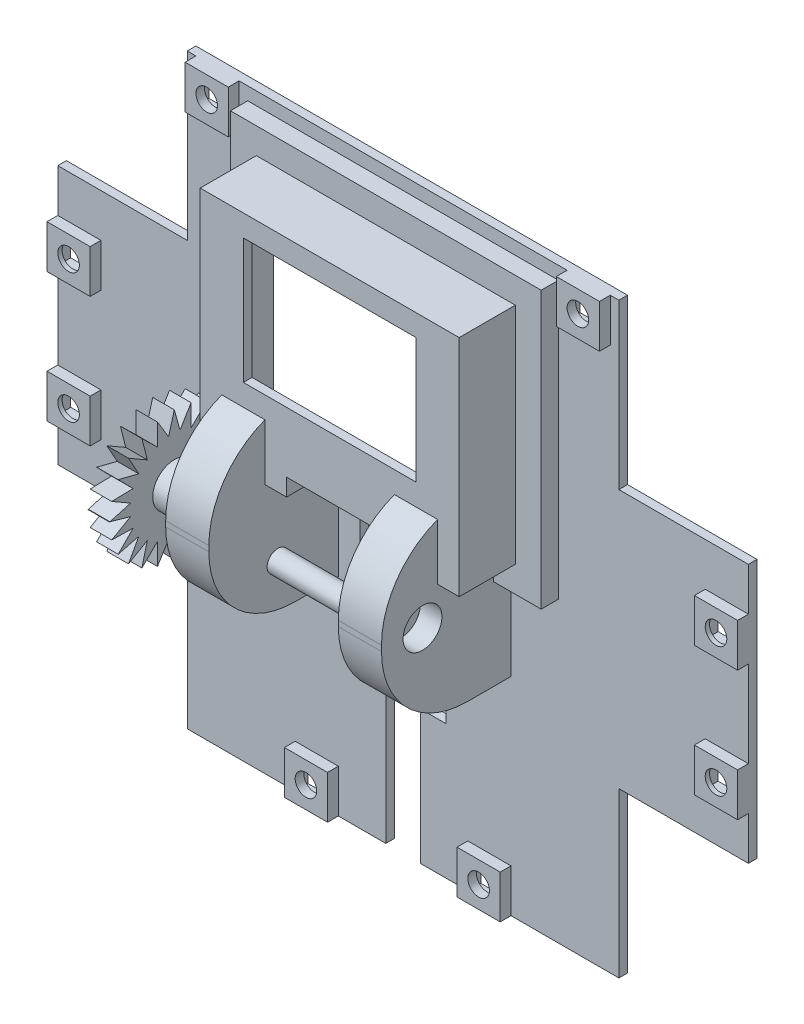
from build123d import *

# Parameters (mm, degrees)
BOSS_EXTRU_1_DEPTH       = 2
BOSS_EXTRU_2_DEPTH       = 4
ESQUISSE3_W              = 68
ESQUISSE3_H              = 60
ESQUISSE3_W_2            = 56
ESQUISSE3_H_2            = 48
BOSS_EXTRU_3_DEPTH       = 2
ESQUISSE4_W              = 60
ESQUISSE4_H              = 52
ESQUISSE4_W_2            = 56
ESQUISSE4_H_2            = 48
BOSS_EXTRU_4_DEPTH       = 13
ESQUISSE5_W              = 56
ESQUISSE5_H              = 48
BOSS_EXTRU_5_DEPTH       = 2
ESQUISSE6_W              = 20
ESQUISSE6_H              = 10
ENL_V_MAT_EXTRU_1_DEPTH  = 35
ESQUISSE9_W              = 2
ESQUISSE9_H              = 40
ESQUISSE9_W_2            = 10
ESQUISSE9_H_2            = 21
BOSS_EXTRU_9_DEPTH       = 30
CONG_5_R                 = 20
ESQUISSE10_W             = 10
ESQUISSE10_H             = 6
BOSS_EXTRU_10_DEPTH      = 26
ESQUISSE11_W             = 10
ESQUISSE11_H             = 13
BOSS_EXTRU_11_DEPTH      = 13
CONG_6_R                 = 20
CONG_7_R                 = 20
ESQUISSE12_R             = 2.5
BOSS_EXTRU_12_DEPTH      = 36
ESQUISSE13_R             = 4.5
ENL_V_MAT_EXTRU_2_DEPTH  = 30
ENL_V_START              = -17
ESQUISSE14_R             = 4.5
ENL_V_MAT_EXTRU_4_DEPTH  = 17
ESQUISSE15_R             = 5
BOSS_EXTRU_13_DEPTH      = 12.5
ESQUISSE16_W             = 1
ESQUISSE16_H             = 1
BOSS_EXTRU_14_DEPTH      = 2
ESQUISSE17_R             = 15
BOSS_EXTRU_16_DEPTH      = 5
ENL_V_START_2            = -16
ESQUISSE18_R             = 4.5
ENL_V_MAT_EXTRU_5_DEPTH  = 16
ENL_V_MAT_EXTRU_7_DEPTH  = 5
ESQUISSE24_W             = 40
ESQUISSE24_H             = 29
ENL_V_MAT_EXTRU_8_DEPTH  = 10
ESQUISSE25_R             = 2.5
ENL_V_MAT_EXTRU_9_DEPTH  = 10
ESQUISSE26_W             = 8
ESQUISSE26_H             = 31
ENL_V_MAT_EXTRU_10_DEPTH = 10
ESQUISSE27_W             = 8
ESQUISSE27_H             = 8
ENL_V_MAT_EXTRU_11_DEPTH = 2.5
ESQUISSE28_W             = 10
ESQUISSE28_H             = 10
ESQUISSE28_W_2           = 8
ESQUISSE28_H_2           = 8
BOSS_EXTRU_17_DEPTH      = 2.5
ESQUISSE29_W             = 8
ESQUISSE29_H             = 8
BOSS_EXTRU_18_DEPTH      = 2
ESQUISSE30_R             = 2.5
ENL_V_MAT_EXTRU_12_DEPTH = 2
ESQUISSE31_W             = 8
ESQUISSE31_H             = 8
ENL_V_MAT_EXTRU_13_DEPTH = 2.5
ESQUISSE32_W             = 10
ESQUISSE32_H             = 10
ESQUISSE32_W_2           = 8
ESQUISSE32_H_2           = 8
BOSS_EXTRU_19_DEPTH      = 2.5
ESQUISSE33_W             = 8
ESQUISSE33_H             = 8
BOSS_EXTRU_20_DEPTH      = 2
ESQUISSE34_R             = 2.5
ENL_V_MAT_EXTRU_14_DEPTH = 2
ESQUISSE35_W             = 2
ESQUISSE35_H             = 60
BOSS_EXTRU_21_DEPTH      = 30
ESQUISSE36_W             = 2
ESQUISSE36_H             = 60
BOSS_EXTRU_22_DEPTH      = 30
ESQUISSE37_W             = 8
ESQUISSE37_H             = 8
ENL_V_MAT_EXTRU_15_DEPTH = 30
ESQUISSE38_W             = 10
ESQUISSE38_H             = 10
ESQUISSE38_W_2           = 8
ESQUISSE38_H_2           = 8
BOSS_EXTRU_23_DEPTH      = 2.5
ESQUISSE39_W             = 1
ESQUISSE39_H             = 8
BOSS_EXTRU_24_DEPTH      = 8
ESQUISSE40_W             = 1
ESQUISSE40_H             = 8
BOSS_EXTRU_25_DEPTH      = 8
ESQUISSE41_R             = 2.5
ENL_V_MAT_EXTRU_16_DEPTH = 8
ESQUISSE42_W             = 8
ESQUISSE42_H             = 8
ENL_V_MAT_EXTRU_17_DEPTH = 8
ESQUISSE43_W             = 10
ESQUISSE43_H             = 10
ESQUISSE43_W_2           = 8
ESQUISSE43_H_2           = 8
BOSS_EXTRU_26_DEPTH      = 2.5
ESQUISSE44_W             = 1
ESQUISSE44_H             = 8
BOSS_EXTRU_27_DEPTH      = 8
ESQUISSE45_W             = 1
ESQUISSE45_H             = 8
BOSS_EXTRU_28_DEPTH      = 8
ESQUISSE46_R             = 2.5
ENL_V_MAT_EXTRU_18_DEPTH = 8
ESQUISSE47_W             = 2
ESQUISSE47_H             = 40
ENL_V_MAT_EXTRU_19_DEPTH = 30


# Some blends are built 0.0001 mm under size
with BuildPart() as part:
    # Esquisse1 → Boss.-Extru.1 (new body)
    with BuildSketch(Plane.XY):
        Polygon((-50, 68), (-50, -68), (-10, -68), (10, -68), (50, -68), (50, 68), align=None)
        Polygon((-10, 3), (-34, 3), (-34, 63), (34, 63), (34, 3), (10, 3), (10, -37), (-10, -37), align=None, mode=Mode.SUBTRACT)
    extrude(amount=BOSS_EXTRU_1_DEPTH)

    # Esquisse2 → Boss.-Extru.2 (add)
    with BuildSketch(Plane.XY.offset(2)):
        Polygon((36, 65), (-36, 65), (-36, 1), (-10, 1), (-10, 3), (-34, 3), (-34, 63), (34, 63), (34, 3), (10, 3), (10, 1), (36, 1), align=None)
    extrude(amount=BOSS_EXTRU_2_DEPTH)

    # Esquisse3 → Boss.-Extru.3 (add)
    with BuildSketch(Plane.XY.offset(6)):
        with Locations((0, 33)):
            Rectangle(ESQUISSE3_W, ESQUISSE3_H)
        with Locations((0, 33)):
            Rectangle(ESQUISSE3_W_2, ESQUISSE3_H_2, mode=Mode.SUBTRACT)
    extrude(amount=-BOSS_EXTRU_3_DEPTH)

    # Esquisse4 → Boss.-Extru.4 (add)
    with BuildSketch(Plane.XY.offset(6)):
        with Locations((0, 33)):
            Rectangle(ESQUISSE4_W, ESQUISSE4_H)
        with Locations((0, 33)):
            Rectangle(ESQUISSE4_W_2, ESQUISSE4_H_2, mode=Mode.SUBTRACT)
    extrude(amount=BOSS_EXTRU_4_DEPTH)

    # Esquisse5 → Boss.-Extru.5 (add)
    with BuildSketch(Plane.XY.offset(19)):
        with Locations((0, 33)):
            Rectangle(ESQUISSE5_W, ESQUISSE5_H)
    extrude(amount=-BOSS_EXTRU_5_DEPTH)

    # Esquisse6 → Enlèv. mat.-Extru.1 (cut)
    with BuildSketch(Plane.XY.offset(19)):
        with Locations((0, 6)):
            Rectangle(ESQUISSE6_W, ESQUISSE6_H)
    extrude(amount=-ENL_V_MAT_EXTRU_1_DEPTH, mode=Mode.SUBTRACT)

    # Esquisse9 → Boss.-Extru.9 (add)
    with BuildSketch(Plane.XY.offset(2)):
        with Locations((-49, 0)):
            Rectangle(ESQUISSE9_W, ESQUISSE9_H)
        with Locations((49, 0)):
            Rectangle(ESQUISSE9_W, ESQUISSE9_H)
        with Locations((-20, -9.5)):
            Rectangle(ESQUISSE9_W_2, ESQUISSE9_H_2)
        with Locations((20, -9.5)):
            Rectangle(ESQUISSE9_W_2, ESQUISSE9_H_2)
    extrude(amount=BOSS_EXTRU_9_DEPTH)

    # Congé5
    cong_5_edges = [part.edges().sort_by_distance(p)[0] for p in [
        (49, -20, 32),
        (49, 20, 32),
        (-49, -20, 32),
        (-49, 20, 32),
    ]]
    fillet(cong_5_edges, radius=CONG_5_R - 0.0001)  # a hair under: the kernel refuses the full size

    # Esquisse10 → Boss.-Extru.10 (add)
    with BuildSketch(Plane.XY.offset(6)):
        with Locations((-20, 4)):
            Rectangle(ESQUISSE10_W, ESQUISSE10_H)
        with Locations((20, 4)):
            Rectangle(ESQUISSE10_W, ESQUISSE10_H)
    extrude(amount=BOSS_EXTRU_10_DEPTH)

    # Esquisse11 → Boss.-Extru.11 (add)
    with BuildSketch(Plane.XY.offset(19)):
        with Locations((-20, 13.5)):
            Rectangle(ESQUISSE11_W, ESQUISSE11_H)
        with Locations((20, 13.5)):
            Rectangle(ESQUISSE11_W, ESQUISSE11_H)
    extrude(amount=BOSS_EXTRU_11_DEPTH)

    # Congé6
    # the kernel refuses this fillet: 20 mm, written as the material it takes off along each edge
    with BuildSketch(Plane(origin=(71.837484988, 20, 32), x_dir=(0, -1, 0), z_dir=(-1, 0, 0)), Plane(origin=(31.837484988, 20, 32), x_dir=(0, -1, 0), z_dir=(-1, 0, 0))) as cong_6_piece_1:
        with BuildLine():
            CenterArc((18.734993995, -20), CONG_6_R, 90, 69.512684885)
            Line((0, -13), (-0.37469988, -12.86))
            ThreePointArc((-0.37469988, -12.86), (-0.4, -6.5), (-0.4, 0))
            Line((-0.4, 0), (0, 0.4))
            Line((0, 0.4), (18.734993995, 0.4))
            Line((18.734993995, 0.4), (18.734993995, 0))
        make_face()
    extrude(amount=103.674969976, mode=Mode.SUBTRACT)

    # Congé7
    cong_7_edges = [part.edges().sort_by_distance(p)[0] for p in [
        (-20, -20, 32),
        (20, -20, 32),
    ]]
    fillet(cong_7_edges, radius=CONG_7_R)

    # Esquisse12 → Boss.-Extru.12 (add)
    with BuildSketch(Plane(origin=(-15, 0, 0), x_dir=(0, 0, -1), z_dir=(1, 0, 0))):
        with Locations(Location((-16, -9.797958971, 0), (0, 0, 180))):
            Circle(ESQUISSE12_R)
    extrude(amount=BOSS_EXTRU_12_DEPTH)

    # Esquisse13 → Enlèv. mat.-Extru.2 (cut)
    with BuildSketch(Plane(origin=(50, 0, 0), x_dir=(0, 0, -1), z_dir=(1, 0, 0))):
        with Locations((-22.5, 0)):
            Circle(ESQUISSE13_R)
    extrude(amount=-ENL_V_MAT_EXTRU_2_DEPTH, mode=Mode.SUBTRACT)

    # Esquisse14 → Enlèv. mat.-Extru.4 (cut)
    with BuildSketch(Plane.ZY.offset(50).offset(ENL_V_START)):
        with Locations(Location((22.5, 0, 0), (0, 0, 180))):
            Circle(ESQUISSE14_R)
    extrude(amount=ENL_V_MAT_EXTRU_4_DEPTH, mode=Mode.SUBTRACT)

    # Esquisse15 → Boss.-Extru.13 (add)
    with BuildSketch(Plane.ZY.offset(25)):
        with Locations(Location((22.5, 0, 0), (0, 0, 180))):
            Circle(ESQUISSE15_R)
    extrude(amount=BOSS_EXTRU_13_DEPTH)

    # Esquisse16 → Boss.-Extru.14 (add)
    with BuildSketch(Plane.XY.offset(2)):
        with Locations((-37, 0.5)):
            Rectangle(ESQUISSE16_W, ESQUISSE16_H)
        with Locations((-37, -0.5)):
            Rectangle(ESQUISSE16_W, ESQUISSE16_H)
    extrude(amount=BOSS_EXTRU_14_DEPTH)

    # Esquisse17 → Boss.-Extru.16 (add)
    with BuildSketch(Plane.ZY.offset(37.5)):
        with Locations((22.5, 0)):
            Circle(ESQUISSE17_R)
    extrude(amount=-BOSS_EXTRU_16_DEPTH)

    # Esquisse18 → Enlèv. mat.-Extru.5 (cut)
    with BuildSketch(Plane.ZY.offset(50).offset(ENL_V_START_2)):
        with Locations(Location((22.5, 0, 0), (0, 0, 180))):
            Circle(ESQUISSE18_R)
    extrude(amount=ENL_V_MAT_EXTRU_5_DEPTH, mode=Mode.SUBTRACT)

    # Esquisse23 → Enlèv. mat.-Extru.7 (cut)
    with BuildSketch(Plane.ZY.offset(37.5)):
        with BuildLine():
            Line((16.249201679, 8.084145326), (14.992638885, 12.986128333))
            ThreePointArc((14.992638885, 12.986128333), (13.360150213, 11.893828058), (11.884385152, 10.597580922))
            Line((11.884385152, 10.597580922), (16.249201679, 8.084145326))
        make_face()
        with BuildLine():
            Line((18.613608679, 9.438661561), (18.613608679, 14.487786667))
            ThreePointArc((18.613608679, 14.487786667), (16.753858418, 13.855751763), (14.992638885, 12.986128333))
            Line((14.992638885, 12.986128333), (18.613608679, 9.438661561))
        make_face()
        with BuildLine():
            Line((21.172520791, 10.263058131), (22.5, 15))
            ThreePointArc((22.5, 15), (20.54, 14.871395362), (18.613608679, 14.487786667))
            Line((18.613608679, 14.487786667), (21.172520791, 10.263058131))
        make_face()
        with BuildLine():
            ThreePointArc((26.386391321, 14.487786667), (24.46, 14.871395362), (22.5, 15))
            Line((22.5, 15), (23.827479209, 10.263058131))
            Line((23.827479209, 10.263058131), (26.386391321, 14.487786667))
        make_face()
        with BuildLine():
            ThreePointArc((30.007361115, 12.986128333), (28.246141582, 13.855751763), (26.386391321, 14.487786667))
            Line((26.386391321, 14.487786667), (26.386391321, 9.438661561))
            Line((26.386391321, 9.438661561), (30.007361115, 12.986128333))
        make_face()
        with BuildLine():
            ThreePointArc((33.115614848, 10.597580922), (31.639849787, 11.893828058), (30.007361115, 12.986128333))
            Line((30.007361115, 12.986128333), (28.750798321, 8.084145326))
            Line((28.750798321, 8.084145326), (33.115614848, 10.597580922))
        make_face()
        with BuildLine():
            ThreePointArc((36.994373579, 3.861752784), (36.365501637, 5.722574977), (35.498873985, 7.485270545))
            Line((35.498873985, 7.485270545), (32.044534805, 3.971329591))
            Line((32.044534805, 3.971329591), (36.994373579, 3.861752784))
        make_face()
        with BuildLine():
            ThreePointArc((35.498873985, 7.485270545), (34.409350934, 9.119614045), (33.115614848, 10.597580922))
            Line((33.115614848, 10.597580922), (30.731443888, 6.271833446))
            Line((30.731443888, 6.271833446), (35.498873985, 7.485270545))
        make_face()
        with BuildLine():
            ThreePointArc((37.499978319, 0.025503813), (37.371395362, 1.96), (36.994373579, 3.861752784))
            Line((36.994373579, 3.861752784), (32.629557052, 1.348317188))
            Line((32.629557052, 1.348317188), (37.40956311, 0))
            Line((37.40956311, 0), (37.499978319, 0.025503813))
        make_face()
        with BuildLine():
            Line((37.499978319, -0.025503813), (37.40956311, 0))
            Line((37.40956311, 0), (32.629557052, -1.348317188))
            Line((32.629557052, -1.348317188), (36.994373579, -3.861752784))
            ThreePointArc((36.994373579, -3.861752784), (37.371395362, -1.96), (37.499978319, -0.025503813))
        make_face()
        with BuildLine():
            ThreePointArc((35.498873985, -7.485270545), (36.365501637, -5.722574977), (36.994373579, -3.861752784))
            Line((36.994373579, -3.861752784), (32.044534805, -3.971329591))
            Line((32.044534805, -3.971329591), (35.498873985, -7.485270545))
        make_face()
        with BuildLine():
            ThreePointArc((33.115614848, -10.597580922), (34.409350934, -9.119614045), (35.498873985, -7.485270545))
            Line((35.498873985, -7.485270545), (30.731443888, -6.271833446))
            Line((30.731443888, -6.271833446), (33.115614848, -10.597580922))
        make_face()
        with BuildLine():
            ThreePointArc((30.007361115, -12.986128333), (31.639849787, -11.893828058), (33.115614848, -10.597580922))
            Line((33.115614848, -10.597580922), (28.750798321, -8.084145326))
            Line((28.750798321, -8.084145326), (30.007361115, -12.986128333))
        make_face()
        with BuildLine():
            ThreePointArc((26.386391321, -14.487786667), (28.246141582, -13.855751763), (30.007361115, -12.986128333))
            Line((30.007361115, -12.986128333), (26.386391321, -9.438661561))
            Line((26.386391321, -9.438661561), (26.386391321, -14.487786667))
        make_face()
        with BuildLine():
            ThreePointArc((22.5, -15), (24.46, -14.871395362), (26.386391321, -14.487786667))
            Line((26.386391321, -14.487786667), (23.821374155, -10.252978772))
            Line((23.821374155, -10.252978772), (22.5, -15))
        make_face()
        with BuildLine():
            Line((21.172520791, -10.263058131), (18.613608679, -14.487786667))
            ThreePointArc((18.613608679, -14.487786667), (20.54, -14.871395362), (22.5, -15))
            Line((22.5, -15), (21.172520791, -10.263058131))
        make_face()
        with BuildLine():
            Line((18.613608679, -9.438661561), (14.992638885, -12.986128333))
            ThreePointArc((14.992638885, -12.986128333), (16.753858418, -13.855751763), (18.613608679, -14.487786667))
            Line((18.613608679, -14.487786667), (18.613608679, -9.438661561))
        make_face()
        with BuildLine():
            Line((16.249201679, -8.084145326), (11.884385152, -10.597580922))
            ThreePointArc((11.884385152, -10.597580922), (13.360150213, -11.893828058), (14.992638885, -12.986128333))
            Line((14.992638885, -12.986128333), (16.249201679, -8.084145326))
        make_face()
        with BuildLine():
            Line((14.268556112, -6.271833446), (9.501126015, -7.485270545))
            ThreePointArc((9.501126015, -7.485270545), (10.590649066, -9.119614045), (11.884385152, -10.597580922))
            Line((11.884385152, -10.597580922), (14.268556112, -6.271833446))
        make_face()
        with BuildLine():
            Line((12.955465195, -3.971329591), (8.005626421, -3.861752784))
            ThreePointArc((8.005626421, -3.861752784), (8.634498363, -5.722574977), (9.501126015, -7.485270545))
            Line((9.501126015, -7.485270545), (12.955465195, -3.971329591))
        make_face()
        with BuildLine():
            Line((12.342295627, -1.364525539), (7.500021681, -0.025503813))
            ThreePointArc((7.500021681, -0.025503813), (7.628604638, -1.96), (8.005626421, -3.861752784))
            Line((8.005626421, -3.861752784), (12.342295627, -1.364525539))
        make_face()
        with BuildLine():
            Line((12.370442948, 1.348317188), (8.005626421, 3.861752784))
            ThreePointArc((8.005626421, 3.861752784), (7.628604638, 1.96), (7.500021681, 0.025503813))
            Line((7.500021681, 0.025503813), (7.59043689, 0))
            Line((7.59043689, 0), (12.370442948, 1.348317188))
        make_face()
        with BuildLine():
            Line((12.955465195, 3.971329591), (9.501126015, 7.485270545))
            ThreePointArc((9.501126015, 7.485270545), (8.634498363, 5.722574977), (8.005626421, 3.861752784))
            Line((8.005626421, 3.861752784), (12.955465195, 3.971329591))
        make_face()
        with BuildLine():
            Line((14.268556112, 6.271833446), (11.884385152, 10.597580922))
            ThreePointArc((11.884385152, 10.597580922), (10.590649066, 9.119614045), (9.501126015, 7.485270545))
            Line((9.501126015, 7.485270545), (14.268556112, 6.271833446))
        make_face()
    extrude(amount=-ENL_V_MAT_EXTRU_7_DEPTH, mode=Mode.SUBTRACT)


with BuildPart() as enl_v_mat_extru_7_piece_1:
    # of the separate pieces the step leaves, piece 1, a body of its own (enl_v_mat_extru_7_pieces)
    add(part.part.solids().sort_by_distance((15, 0, 32))[0])

    # Esquisse24 → Enlèv. mat.-Extru.8 (cut)
    with BuildSketch(Plane.XY.offset(19)):
        with Locations((0, 39.5)):
            Rectangle(ESQUISSE24_W, ESQUISSE24_H)
    extrude(amount=-ENL_V_MAT_EXTRU_8_DEPTH, mode=Mode.SUBTRACT)

    # Esquisse25 → Enlèv. mat.-Extru.9 (cut)
    with BuildSketch(Plane.XY.offset(2)):
        with Locations((-43, 63)):
            Circle(ESQUISSE25_R)
        with Locations((43, 63)):
            Circle(ESQUISSE25_R)
    extrude(amount=-ENL_V_MAT_EXTRU_9_DEPTH, mode=Mode.SUBTRACT)

    # Esquisse26 → Enlèv. mat.-Extru.10 (cut)
    with BuildSketch(Plane.XY.offset(2)):
        with Locations((0, -52.5)):
            Rectangle(ESQUISSE26_W, ESQUISSE26_H)
    extrude(amount=-ENL_V_MAT_EXTRU_10_DEPTH, mode=Mode.SUBTRACT)

    # Esquisse27 → Enlèv. mat.-Extru.11 (cut)
    with BuildSketch(Plane(origin=(0, 0, 0), x_dir=(-1, 0, 0), z_dir=(0, 0, -1))):
        with Locations((-20, -63)):
            Rectangle(ESQUISSE27_W, ESQUISSE27_H)
        with Locations((20, -63)):
            Rectangle(ESQUISSE27_W, ESQUISSE27_H)
    extrude(amount=-ENL_V_MAT_EXTRU_11_DEPTH, mode=Mode.SUBTRACT)

    # Esquisse28 → Boss.-Extru.17 (add)
    # profile 1 of 2: a face of its own
    with BuildSketch(Plane.XY.offset(2)):
        with Locations((-20, -63)):
            Rectangle(ESQUISSE28_W, ESQUISSE28_H)
        with Locations((-20, -63)):
            Rectangle(ESQUISSE28_W_2, ESQUISSE28_H_2, mode=Mode.SUBTRACT)
    # profile 2 of 2: a face of its own
    with BuildSketch(Plane.XY.offset(2)):
        with Locations((20, -63)):
            Rectangle(ESQUISSE28_W, ESQUISSE28_H)
        with Locations((20, -63)):
            Rectangle(ESQUISSE28_W_2, ESQUISSE28_H_2, mode=Mode.SUBTRACT)
    extrude(amount=BOSS_EXTRU_17_DEPTH)

    # Esquisse29 → Boss.-Extru.18 (add)
    with BuildSketch(Plane.XY.offset(4.5)):
        with Locations((-20, -63)):
            Rectangle(ESQUISSE29_W, ESQUISSE29_H)
        with Locations((20, -63)):
            Rectangle(ESQUISSE29_W, ESQUISSE29_H)
    extrude(amount=-BOSS_EXTRU_18_DEPTH)

    # Esquisse30 → Enlèv. mat.-Extru.12 (cut)
    with BuildSketch(Plane.XY.offset(4.5)):
        with Locations((-20, -63)):
            Circle(ESQUISSE30_R)
        with Locations(Location((20, -63, 0), (0, 0, 180))):
            Circle(ESQUISSE30_R)
    extrude(amount=-ENL_V_MAT_EXTRU_12_DEPTH, mode=Mode.SUBTRACT)

    # Esquisse31 → Enlèv. mat.-Extru.13 (cut)
    with BuildSketch(Plane(origin=(0, 0, 0), x_dir=(-1, 0, 0), z_dir=(0, 0, -1))):
        with Locations((-43, 63)):
            Rectangle(ESQUISSE31_W, ESQUISSE31_H)
        with Locations((43, 63)):
            Rectangle(ESQUISSE31_W, ESQUISSE31_H)
    extrude(amount=-ENL_V_MAT_EXTRU_13_DEPTH, mode=Mode.SUBTRACT)

    # Esquisse32 → Boss.-Extru.19 (add)
    # profile 1 of 2: a face of its own
    with BuildSketch(Plane.XY.offset(2)):
        with Locations((43, 63)):
            Rectangle(ESQUISSE32_W, ESQUISSE32_H)
        with Locations((43, 63)):
            Rectangle(ESQUISSE32_W_2, ESQUISSE32_H_2, mode=Mode.SUBTRACT)
    # profile 2 of 2: a face of its own
    with BuildSketch(Plane.XY.offset(2)):
        with Locations((-43, 63)):
            Rectangle(ESQUISSE32_W, ESQUISSE32_H)
        with Locations((-43, 63)):
            Rectangle(ESQUISSE32_W_2, ESQUISSE32_H_2, mode=Mode.SUBTRACT)
    extrude(amount=BOSS_EXTRU_19_DEPTH)

    # Esquisse33 → Boss.-Extru.20 (add)
    with BuildSketch(Plane.XY.offset(4.5)):
        with Locations((-43, 63)):
            Rectangle(ESQUISSE33_W, ESQUISSE33_H)
        with Locations((43, 63)):
            Rectangle(ESQUISSE33_W, ESQUISSE33_H)
    extrude(amount=-BOSS_EXTRU_20_DEPTH)

    # Esquisse34 → Enlèv. mat.-Extru.14 (cut)
    with BuildSketch(Plane.XY.offset(4.5)):
        with Locations((-43, 63)):
            Circle(ESQUISSE34_R)
        with Locations((43, 63)):
            Circle(ESQUISSE34_R)
    extrude(amount=-ENL_V_MAT_EXTRU_14_DEPTH, mode=Mode.SUBTRACT)

    # Esquisse35 → Boss.-Extru.21 (add)
    with BuildSketch(Plane.ZY.offset(50)):
        with Locations((1, 0)):
            Rectangle(ESQUISSE35_W, ESQUISSE35_H)
    extrude(amount=BOSS_EXTRU_21_DEPTH)

    # Esquisse36 → Boss.-Extru.22 (add)
    with BuildSketch(Plane(origin=(50, 0, 0), x_dir=(0, 0, -1), z_dir=(1, 0, 0))):
        with Locations((-1, 0)):
            Rectangle(ESQUISSE36_W, ESQUISSE36_H)
    extrude(amount=BOSS_EXTRU_22_DEPTH)

    # Esquisse37 → Enlèv. mat.-Extru.15 (cut)
    with BuildSketch(Plane.XY.offset(2)):
        with Locations((-75, 15)):
            Rectangle(ESQUISSE37_W, ESQUISSE37_H)
        with Locations((-75, -15)):
            Rectangle(ESQUISSE37_W, ESQUISSE37_H)
    extrude(amount=-ENL_V_MAT_EXTRU_15_DEPTH, mode=Mode.SUBTRACT)

    # Esquisse38 → Boss.-Extru.23 (add)
    # profile 1 of 2: a face of its own
    with BuildSketch(Plane.XY.offset(2)):
        with Locations((-75, 15)):
            Rectangle(ESQUISSE38_W, ESQUISSE38_H)
        with Locations((-75, 15)):
            Rectangle(ESQUISSE38_W_2, ESQUISSE38_H_2, mode=Mode.SUBTRACT)
    # profile 2 of 2: a face of its own
    with BuildSketch(Plane.XY.offset(2)):
        with Locations((-75, -15)):
            Rectangle(ESQUISSE38_W, ESQUISSE38_H)
        with Locations((-75, -15)):
            Rectangle(ESQUISSE38_W_2, ESQUISSE38_H_2, mode=Mode.SUBTRACT)
    extrude(amount=BOSS_EXTRU_23_DEPTH)

    # Esquisse39 → Boss.-Extru.24 (add)
    with BuildSketch(Plane.ZY.offset(71)):
        with Locations((4, 15)):
            Rectangle(ESQUISSE39_W, ESQUISSE39_H)
    extrude(amount=BOSS_EXTRU_24_DEPTH)

    # Esquisse40 → Boss.-Extru.25 (add)
    with BuildSketch(Plane.ZY.offset(71)):
        with Locations((4, -15)):
            Rectangle(ESQUISSE40_W, ESQUISSE40_H)
    extrude(amount=BOSS_EXTRU_25_DEPTH)

    # Esquisse41 → Enlèv. mat.-Extru.16 (cut)
    with BuildSketch(Plane.XY.offset(4.5)):
        with Locations((-75, 15)):
            Circle(ESQUISSE41_R)
        with Locations((-75, -15)):
            Circle(ESQUISSE41_R)
    extrude(amount=-ENL_V_MAT_EXTRU_16_DEPTH, mode=Mode.SUBTRACT)

    # Esquisse42 → Enlèv. mat.-Extru.17 (cut)
    with BuildSketch(Plane.XY.offset(2)):
        with Locations((75, 15)):
            Rectangle(ESQUISSE42_W, ESQUISSE42_H)
        with Locations((75, -15)):
            Rectangle(ESQUISSE42_W, ESQUISSE42_H)
    extrude(amount=-ENL_V_MAT_EXTRU_17_DEPTH, mode=Mode.SUBTRACT)

    # Esquisse43 → Boss.-Extru.26 (add)
    # profile 1 of 2: a face of its own
    with BuildSketch(Plane.XY.offset(2)):
        with Locations((75, 15)):
            Rectangle(ESQUISSE43_W, ESQUISSE43_H)
        with Locations((75, 15)):
            Rectangle(ESQUISSE43_W_2, ESQUISSE43_H_2, mode=Mode.SUBTRACT)
    # profile 2 of 2: a face of its own
    with BuildSketch(Plane.XY.offset(2)):
        with Locations((75, -15)):
            Rectangle(ESQUISSE43_W, ESQUISSE43_H)
        with Locations((75, -15)):
            Rectangle(ESQUISSE43_W_2, ESQUISSE43_H_2, mode=Mode.SUBTRACT)
    extrude(amount=BOSS_EXTRU_26_DEPTH)

    # Esquisse44 → Boss.-Extru.27 (add)
    with BuildSketch(Plane(origin=(71, 0, 0), x_dir=(0, 0, -1), z_dir=(1, 0, 0))):
        with Locations((-4, 15)):
            Rectangle(ESQUISSE44_W, ESQUISSE44_H)
    extrude(amount=BOSS_EXTRU_27_DEPTH)

    # Esquisse45 → Boss.-Extru.28 (add)
    with BuildSketch(Plane(origin=(71, 0, 0), x_dir=(0, 0, -1), z_dir=(1, 0, 0))):
        with Locations((-4, -15)):
            Rectangle(ESQUISSE45_W, ESQUISSE45_H)
    extrude(amount=BOSS_EXTRU_28_DEPTH)

    # Esquisse46 → Enlèv. mat.-Extru.18 (cut)
    with BuildSketch(Plane.XY.offset(4.5)):
        with Locations((75, -15)):
            Circle(ESQUISSE46_R)
        with Locations(Location((75, 15, 0), (0, 0, 270))):
            Circle(ESQUISSE46_R)
    extrude(amount=-ENL_V_MAT_EXTRU_18_DEPTH, mode=Mode.SUBTRACT)

    # Esquisse47 → Enlèv. mat.-Extru.19 (cut)
    with BuildSketch(Plane.XY.offset(2)):
        with Locations((-49, 0)):
            Rectangle(ESQUISSE47_W, ESQUISSE47_H)
        with Locations((49, 0)):
            Rectangle(ESQUISSE47_W, ESQUISSE47_H)
    extrude(amount=ENL_V_MAT_EXTRU_19_DEPTH, mode=Mode.SUBTRACT)


with BuildPart() as enl_v_mat_extru_7_piece_2:
    # of the separate pieces the step leaves, piece 2, a body of its own (enl_v_mat_extru_7_pieces)
    add(part.part.solids().sort_by_distance((-32.5, -0.025503813, 37.499978319))[0])


solid = Compound([enl_v_mat_extru_7_piece_1.part, enl_v_mat_extru_7_piece_2.part])
